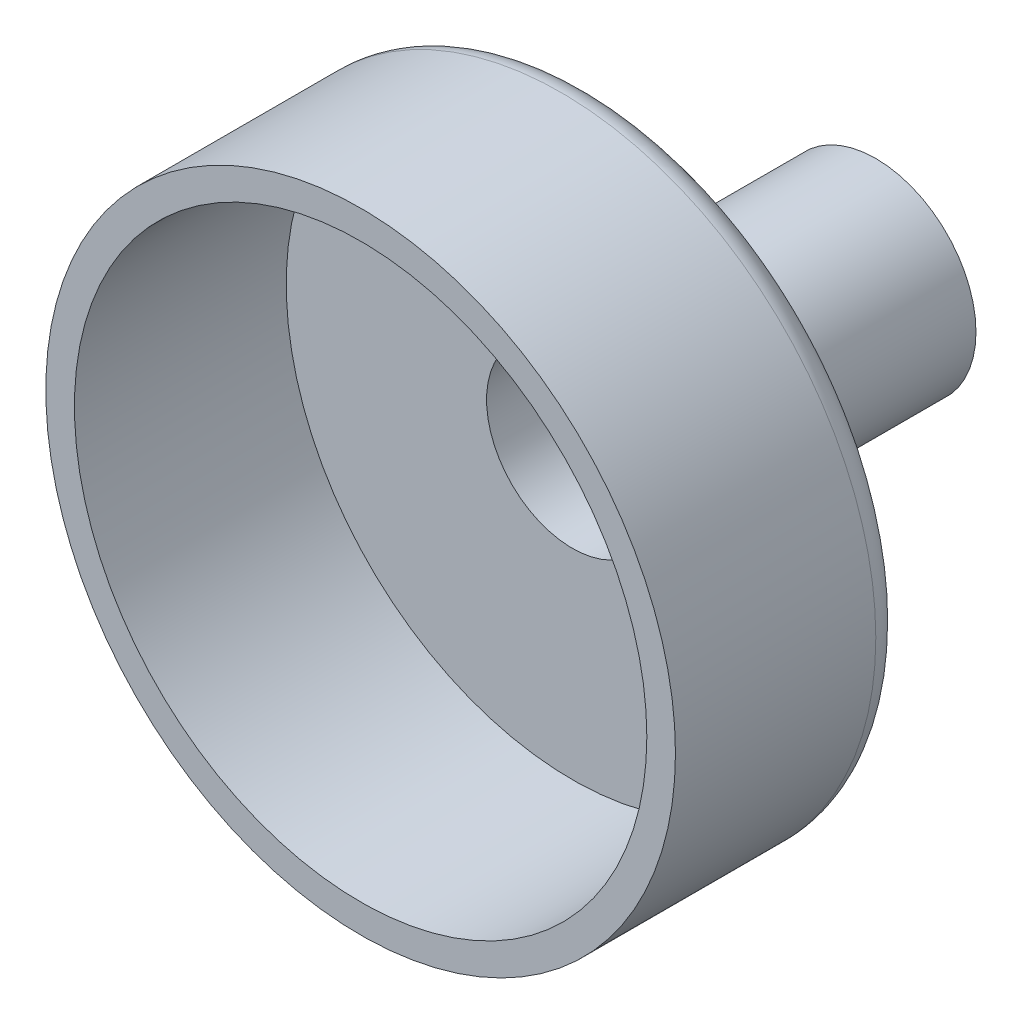
from build123d import *

# Parameters (mm, degrees)
SKETCH1_R           = 100
SKETCH1_R_2         = 14
SKETCH1_R_3         = 2.25
SKETCH1_R_4         = 7
SKETCH1_R_5         = 6.9
BOSS_EXTRUDE1_DEPTH = 6
SKETCH1_3_R         = 110
SKETCH1_3_R_2       = 100
BOSS_EXTRUDE2_DEPTH = 80
BOSS_EXTRUDE3_START = -5
SKETCH1_10_R        = 17
SKETCH1_10_R_2      = 10.75
SKETCH1_10_R_3      = 10
SKETCH1_10_R_4      = 7
SKETCH1_10_R_5      = 6.9
SKETCH1_10_R_6      = 3
SKETCH1_10_R_7      = 5
SKETCH1_10_R_8      = 2.25
BOSS_EXTRUDE3_DEPTH = 5
FILLET1_R           = 10
SKETCH2_R           = 35
BOSS_EXTRUDE4_DEPTH = 100
SKETCH6_R           = 30
CUT_EXTRUDE3_DEPTH  = 100


with BuildPart() as part:
    # Sketch1 → Boss-Extrude1 (new body)
    with BuildSketch(Plane.XY):
        Circle(SKETCH1_R)
        with Locations((0, 65)):
            Circle(SKETCH1_R_2, mode=Mode.SUBTRACT)
        with Locations((-64.444626073, 54.419906461)):
            Circle(SKETCH1_R_3, mode=Mode.SUBTRACT)
        with BuildLine():
            ThreePointArc((-47.821809018, 65), (-41.121809018, 71.7), (-34.421809018, 65))
            ThreePointArc((-34.421809018, 65), (-41.121809018, 58.3), (-47.821809018, 65))
        make_face(mode=Mode.SUBTRACT)
        with Locations((41.121809018, 30)):
            Circle(SKETCH1_R_4, mode=Mode.SUBTRACT)
        with Locations((41.121809018, 65)):
            Circle(SKETCH1_R_5, mode=Mode.SUBTRACT)
    extrude(amount=BOSS_EXTRUDE1_DEPTH)

    # Sketch1<3> → Boss-Extrude2 (add)
    with BuildSketch(Plane.XY):
        Circle(SKETCH1_3_R)
        Circle(SKETCH1_3_R_2, mode=Mode.SUBTRACT)
    extrude(amount=BOSS_EXTRUDE2_DEPTH)

    # Sketch1<10> → Boss-Extrude3 (add)
    # profile 1 of 5: a face of its own
    with BuildSketch(Plane.XY.offset(BOSS_EXTRUDE3_START)):
        with Locations((0, 65)):
            Circle(SKETCH1_10_R)
        with Locations((0, 65)):
            Circle(SKETCH1_10_R_2, mode=Mode.SUBTRACT)
    # profile 2 of 5: a face of its own
    with BuildSketch(Plane.XY.offset(BOSS_EXTRUDE3_START)):
        with Locations((41.121809018, 30)):
            Circle(SKETCH1_10_R_3)
        with Locations((41.121809018, 30)):
            Circle(SKETCH1_10_R_4, mode=Mode.SUBTRACT)
    # profile 3 of 5: a face of its own
    with BuildSketch(Plane.XY.offset(BOSS_EXTRUDE3_START)):
        with Locations((41.121809018, 65)):
            Circle(SKETCH1_10_R_3)
        with Locations((41.121809018, 65)):
            Circle(SKETCH1_10_R_5, mode=Mode.SUBTRACT)
    # profile 4 of 5: a face of its own
    with BuildSketch(Plane.XY.offset(BOSS_EXTRUDE3_START)):
        with Locations((-41.121809018, 65)):
            Circle(SKETCH1_10_R_3)
        with Locations((-41.121809018, 65)):
            Circle(SKETCH1_10_R_6, mode=Mode.SUBTRACT)
    # profile 5 of 5: a face of its own
    with BuildSketch(Plane.XY.offset(BOSS_EXTRUDE3_START)):
        with Locations((-64.444626073, 54.419906461)):
            Circle(SKETCH1_10_R_7)
        with Locations((-64.444626073, 54.419906461)):
            Circle(SKETCH1_10_R_8, mode=Mode.SUBTRACT)
    extrude(amount=BOSS_EXTRUDE3_DEPTH)

    # Fillet1
    fillet1_edges = [part.edges().sort_by_distance(p)[0] for p in [
        (-110, 0, 0),
    ]]
    fillet(fillet1_edges, radius=FILLET1_R)

    # Sketch2 → Boss-Extrude4 (add)
    with BuildSketch(Plane(origin=(0, 0, 0), x_dir=(-1, 0, 0), z_dir=(0, 0, -1))):
        Circle(SKETCH2_R)
    extrude(amount=BOSS_EXTRUDE4_DEPTH)

    # Sketch6 → Cut-Extrude3 (cut)
    with BuildSketch(Plane.XY.offset(6)):
        Circle(SKETCH6_R)
    extrude(amount=-CUT_EXTRUDE3_DEPTH, mode=Mode.SUBTRACT)


solid = part.part
